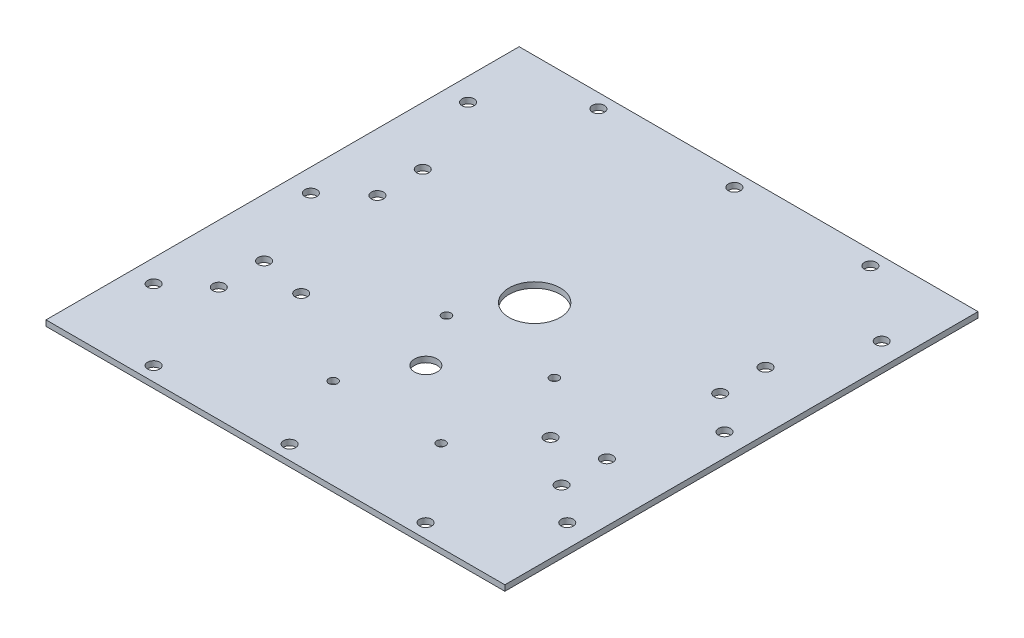
from build123d import *

# Parameters (mm, degrees)
SKETCH1_W          = 315.9125
SKETCH1_H          = 265.1125
SKETCH1_R          = 3.3782
SKETCH1_R_2        = 14.351
SKETCH1_R_3        = 6.35
SKETCH1_R_4        = 2.4892
BASE_FLANGE1_DEPTH = 3.175
SKETCH2_W          = 29.4
SKETCH2_H          = 265.1125
CUT_EXTRUDE1_DEPTH = 413.426267274


# Sheet-metal steps are written as plain solids
with BuildPart() as part:
    # Sketch1 → Base-Flange1 (new body)
    with BuildSketch(Plane(origin=(0, 0, 0), x_dir=(1, 0, 0), z_dir=(0, 1, 0))):
        with Locations((-157.95625, 132.55625)):
            Rectangle(SKETCH1_W, SKETCH1_H)
        with Locations(Location((-254, 64.29375, 0), (0, 0, 270))):
            Circle(SKETCH1_R, mode=Mode.SUBTRACT)
        with Locations(Location((-254, 89.69375, 0), (0, 0, 270))):
            Circle(SKETCH1_R, mode=Mode.SUBTRACT)
        with Locations(Location((-254, 153.19375, 0), (0, 0, 270))):
            Circle(SKETCH1_R, mode=Mode.SUBTRACT)
        with Locations(Location((-254, 178.59375, 0), (0, 0, 270))):
            Circle(SKETCH1_R, mode=Mode.SUBTRACT)
        with Locations(Location((-61.9125, 64.29375, 0), (0, 0, 90))):
            Circle(SKETCH1_R, mode=Mode.SUBTRACT)
        with Locations(Location((-61.9125, 89.69375, 0), (0, 0, 90))):
            Circle(SKETCH1_R, mode=Mode.SUBTRACT)
        with Locations(Location((-61.9125, 153.19375, 0), (0, 0, 90))):
            Circle(SKETCH1_R, mode=Mode.SUBTRACT)
        with Locations(Location((-61.9125, 178.59375, 0), (0, 0, 90))):
            Circle(SKETCH1_R, mode=Mode.SUBTRACT)
        with Locations(Location((-157.95625, 145.25625, 0), (0, 0, 270))):
            Circle(SKETCH1_R_2, mode=Mode.SUBTRACT)
        with Locations(Location((-157.95625, 84.29625, 0), (0, 0, 270))):
            Circle(SKETCH1_R_3, mode=Mode.SUBTRACT)
        with Locations(Location((-176.37125, 114.26825, 0), (0, 0, 270))):
            Circle(SKETCH1_R_4, mode=Mode.SUBTRACT)
        with Locations(Location((-115.91925, 114.26825, 0), (0, 0, 270))):
            Circle(SKETCH1_R_4, mode=Mode.SUBTRACT)
        with Locations(Location((-115.91925, 50.76825, 0), (0, 0, 270))):
            Circle(SKETCH1_R_4, mode=Mode.SUBTRACT)
        with Locations(Location((-176.37125, 50.76825, 0), (0, 0, 270))):
            Circle(SKETCH1_R_4, mode=Mode.SUBTRACT)
        with Locations(Location((-234.15625, 7.9375, 0), (0, 0, 270))):
            Circle(SKETCH1_R, mode=Mode.SUBTRACT)
        with Locations(Location((-157.95625, 7.9375, 0), (0, 0, 270))):
            Circle(SKETCH1_R, mode=Mode.SUBTRACT)
        with Locations(Location((-81.75625, 7.9375, 0), (0, 0, 270))):
            Circle(SKETCH1_R, mode=Mode.SUBTRACT)
        with Locations(Location((-157.95625, 257.175, 0), (0, 0, 270))):
            Circle(SKETCH1_R, mode=Mode.SUBTRACT)
        with Locations(Location((-81.75625, 257.175, 0), (0, 0, 270))):
            Circle(SKETCH1_R, mode=Mode.SUBTRACT)
        with Locations(Location((-234.15625, 257.175, 0), (0, 0, 270))):
            Circle(SKETCH1_R, mode=Mode.SUBTRACT)
        with Locations(Location((-227.80625, 84.29625, 0), (0, 0, 270))):
            Circle(SKETCH1_R, mode=Mode.SUBTRACT)
        with Locations(Location((-88.10625, 84.29625, 0), (0, 0, 270))):
            Circle(SKETCH1_R, mode=Mode.SUBTRACT)
        with Locations(Location((-273.84375, 223.8375, 0), (0, 0, 270))):
            Circle(SKETCH1_R, mode=Mode.SUBTRACT)
        with Locations(Location((-273.84375, 135.73125, 0), (0, 0, 270))):
            Circle(SKETCH1_R, mode=Mode.SUBTRACT)
        with Locations(Location((-273.84375, 47.625, 0), (0, 0, 270))):
            Circle(SKETCH1_R, mode=Mode.SUBTRACT)
        with Locations(Location((-42.06875, 223.8375, 0), (0, 0, 90))):
            Circle(SKETCH1_R, mode=Mode.SUBTRACT)
        with Locations(Location((-42.06875, 135.73125, 0), (0, 0, 90))):
            Circle(SKETCH1_R, mode=Mode.SUBTRACT)
        with Locations(Location((-42.06875, 47.625, 0), (0, 0, 90))):
            Circle(SKETCH1_R, mode=Mode.SUBTRACT)
    extrude(amount=-BASE_FLANGE1_DEPTH)

    # Sketch2 → Cut-Extrude1 (cut, through all)
    with BuildSketch(Plane(origin=(0, 0, 0), x_dir=(1, 0, 0), z_dir=(0, 1, 0))):
        with Locations((-301.2125, 132.55625)):
            Rectangle(SKETCH2_W, SKETCH2_H)
        with Locations((-14.7, 132.55625)):
            Rectangle(SKETCH2_W, SKETCH2_H)
    extrude(amount=-CUT_EXTRUDE1_DEPTH, mode=Mode.SUBTRACT)


solid = part.part
